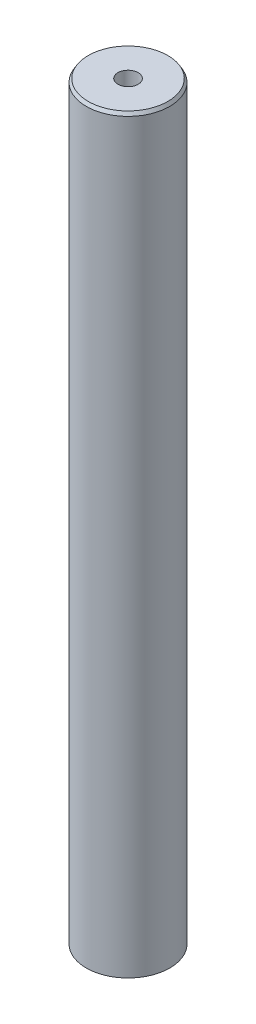
from build123d import *
from OCP.BRepFilletAPI import BRepFilletAPI_MakeChamfer

# Parameters (mm, degrees)
SKETCH1_R           = 5
BOSS_EXTRUDE1_DEPTH = 90.01444449
SKETCH2_R           = 1.212727241
CUT_EXTRUDE1_DEPTH  = 91.291750547
CHAMFER1_SIZE       = 0.400726776
CHAMFER1_SIZE2      = 0.231359712


with BuildPart() as part:
    # Sketch1 → Boss-Extrude1 (new body)
    with BuildSketch(Plane(origin=(0, 0, 0), x_dir=(1, 0, 0), z_dir=(0, 1, 0))):
        Circle(SKETCH1_R)
    extrude(amount=BOSS_EXTRUDE1_DEPTH)

    # Sketch2 → Cut-Extrude1 (cut, through all)
    with BuildSketch(Plane(origin=(0, 0, 0), x_dir=(1, 0, 0), z_dir=(0, 1, 0))):
        Circle(SKETCH2_R)
    extrude(amount=CUT_EXTRUDE1_DEPTH, mode=Mode.SUBTRACT)

    # Chamfer1: one chamfer whose edges measure the first distance from different faces: ONE call of the kernel's chamfer builder (chamfer() names one face for all edges)
    chamfer1_edges_1 = [part.edges().sort_by_distance(p)[0] for p in [
        (-5, 90.01444449, 0),
    ]]
    chamfer1_side_1 = [part.faces().sort_by_distance(p)[0] for p in [
        (-5, 45.007222245, 0),
    ]]
    chamfer1_edges_2 = [part.edges().sort_by_distance(p)[0] for p in [
        (-5, 0, 0),
    ]]
    chamfer1_side_2 = [part.faces().sort_by_distance(p)[0] for p in [
        (-4.858578644, 0, 0),
    ]]
    chamfer1 = BRepFilletAPI_MakeChamfer(part.part.solid().wrapped)
    for e in chamfer1_edges_1:
        chamfer1.Add(CHAMFER1_SIZE, CHAMFER1_SIZE2, e.wrapped, chamfer1_side_1[0].wrapped)  # the first distance lies on this face
    for e in chamfer1_edges_2:
        chamfer1.Add(CHAMFER1_SIZE, CHAMFER1_SIZE2, e.wrapped, chamfer1_side_2[0].wrapped)  # the first distance lies on this face
    add(Compound.cast(chamfer1.Shape()), mode=Mode.REPLACE)


solid = part.part
